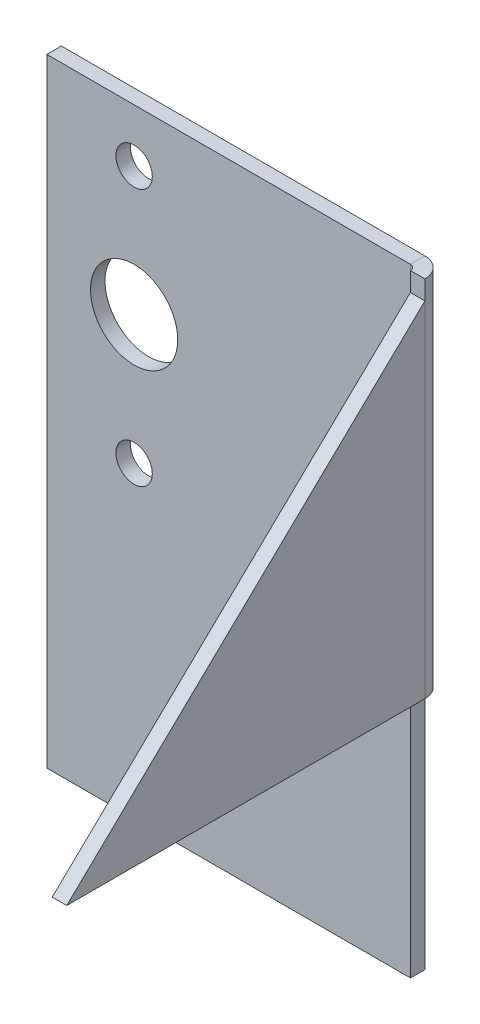
from build123d import *

# Parameters (mm, degrees)
CROQUIS1_W             = 50
CROQUIS1_H             = 85
BRIDA_BASE1_DEPTH      = 2
BRIDA_DE_ARISTA1_DEPTH = 85
DESDOBLAR1_START       = -42.5
DESDOBLAR1_DEPTH       = 85
DESDOBLAR1_2_DEPTH     = 85
CROQUIS9_W             = 49.2634
CROQUIS9_H             = 35
CROQUIS9_W_2           = 2.727844901
CORTAR_EXTRUIR1_DEPTH  = 10
DOBLAR1_START          = -7.5
DOBLAR1_DEPTH          = 50
DOBLAR1_2_DEPTH        = 50
DOBLAR1_START_2        = 27.727844901
DOBLAR1_3_DEPTH        = 50.272155099
DOBLAR1_START_3        = 25.7366
DOBLAR1_4_DEPTH        = 2
CROQUIS11_R            = 6
CROQUIS11_R_2          = 2.5
CORTAR_EXTRUIR2_DEPTH  = 10


with BuildPart() as part:
    # Brida base1: sheet metal written as solids
    # Croquis1 → Brida base1 (new body)
    with BuildSketch(Plane.XY):
        Rectangle(CROQUIS1_W, CROQUIS1_H)
    extrude(amount=-BRIDA_BASE1_DEPTH)

    # Brida de arista1: sheet metal written as solids
    # Brida de arista1 section (on a plane across the edge) → Brida de arista1 (add)
    with BuildSketch(Plane(origin=(25.7366, -42.5, 0), x_dir=(-1, 0, 0), z_dir=(0, 1, 0))):
        with BuildLine():
            Line((-2, 0.7366), (-2, 50))
            Line((-2, 50), (0, 50))
            Line((0, 50), (0, 0.7366))
            ThreePointArc((0, 0.7366), (0.215745145, 0.215745145), (0.7366, 0))
            Line((0.7366, 0), (0.7366, -2))
            ThreePointArc((0.7366, -2), (-1.198468417, -1.198468417), (-2, 0.7366))
        make_face()
    extrude(amount=BRIDA_DE_ARISTA1_DEPTH)

    # Desdoblar1: read off the stored shape, not the designer's step
    # Desdoblar1 outline → Desdoblar1 (cut)
    with BuildSketch(Plane(origin=(0, 0, 0), x_dir=(1, 0, 0), z_dir=(0, 1, 0)).offset(DESDOBLAR1_START)):
        with BuildLine():
            ThreePointArc((27.7366, -0.7366), (27.711233029, -0.364854094), (27.635602398, 0))
            Line((27.635602398, 0), (25, 0))
            ThreePointArc((25, 0), (25.520854855, -0.215745145), (25.7366, -0.7366))
            Line((25.7366, -0.7366), (25.7366, -50))
            Line((25.7366, -50), (27.7366, -50))
            Line((27.7366, -50), (27.7366, -0.7366))
        make_face()
    extrude(amount=DESDOBLAR1_DEPTH, mode=Mode.SUBTRACT)

    # Desdoblar1 2 outline → Desdoblar1 2 (add)
    with BuildSketch(Plane(origin=(0, 0, 0), x_dir=(1, 0, 0), z_dir=(0, 1, 0)).offset(DESDOBLAR1_START)):
        with BuildLine():
            Line((76.991244901, 2), (25, 2))
            ThreePointArc((25, 2), (26.654267209, 1.443395312), (27.635602398, 0))
            Line((27.635602398, 0), (76.991244901, 0))
            Line((76.991244901, 0), (76.991244901, 2))
        make_face()
    extrude(amount=DESDOBLAR1_2_DEPTH)

    # Croquis9 → Cortar-Extruir1 (cut)
    with BuildSketch(Plane.XY):
        Polygon((27.727844901, 39.876630521), (76.991244901, -7.5), (76.991244901, 42.5), (27.727844901, 42.5), align=None)
        with Locations((52.359544901, -25)):
            Rectangle(CROQUIS9_W, CROQUIS9_H)
        with Locations((26.36392245, -25)):
            Rectangle(CROQUIS9_W_2, CROQUIS9_H)
    extrude(amount=-CORTAR_EXTRUIR1_DEPTH, mode=Mode.SUBTRACT)

    # Doblar1: read off the stored shape, not the designer's step
    # Doblar1 outline → Doblar1 (cut)
    with BuildSketch(Plane(origin=(0, 0, 0), x_dir=(1, 0, 0), z_dir=(0, 1, 0)).offset(DOBLAR1_START)):
        with BuildLine():
            ThreePointArc((25, 2), (26.654267209, 1.443395312), (27.635602398, 0))
            Line((27.635602398, 0), (27.727844901, 0))
            Line((27.727844901, 0), (27.727844901, 2))
            Line((27.727844901, 2), (25, 2))
        make_face()
    extrude(amount=DOBLAR1_DEPTH, mode=Mode.SUBTRACT)

    # Doblar1 2 outline → Doblar1 2 (add)
    with BuildSketch(Plane(origin=(0, 0, 0), x_dir=(1, 0, 0), z_dir=(0, 1, 0)).offset(DOBLAR1_START)):
        with BuildLine():
            ThreePointArc((25, 0), (25.520854855, -0.215745145), (25.7366, -0.7366))
            Line((25.7366, -0.7366), (27.7366, -0.7366))
            ThreePointArc((27.7366, -0.7366), (27.711233029, -0.364854094), (27.635602398, 0))
            Line((27.635602398, 0), (25, 0))
        make_face()
    extrude(amount=DOBLAR1_2_DEPTH)

    # Doblar1 3 outline → Doblar1 3 (cut)
    with BuildSketch(Plane.YZ.offset(DOBLAR1_START_2)):
        Polygon((42.508419782, -2), (40.585019021, 0), (-7.5, 0), (-7.5, -2), align=None)
    extrude(amount=DOBLAR1_3_DEPTH, mode=Mode.SUBTRACT)

    # Doblar1 4 outline → Doblar1 4 (add)
    with BuildSketch(Plane.YZ.offset(DOBLAR1_START_3)):
        Polygon((-7.5, 50), (-7.5, 0.7366), (39.876630521, 0.7366), align=None)
    extrude(amount=DOBLAR1_4_DEPTH)

    # Croquis11 → Cortar-Extruir2 (cut)
    with BuildSketch(Plane.XY):
        with Locations((-13, 17.5)):
            Circle(CROQUIS11_R)
        with Locations((-13, -0.2)):
            Circle(CROQUIS11_R_2)
        with Locations((-13, 35.2)):
            Circle(CROQUIS11_R_2)
    extrude(amount=-CORTAR_EXTRUIR2_DEPTH, mode=Mode.SUBTRACT)


solid = part.part
